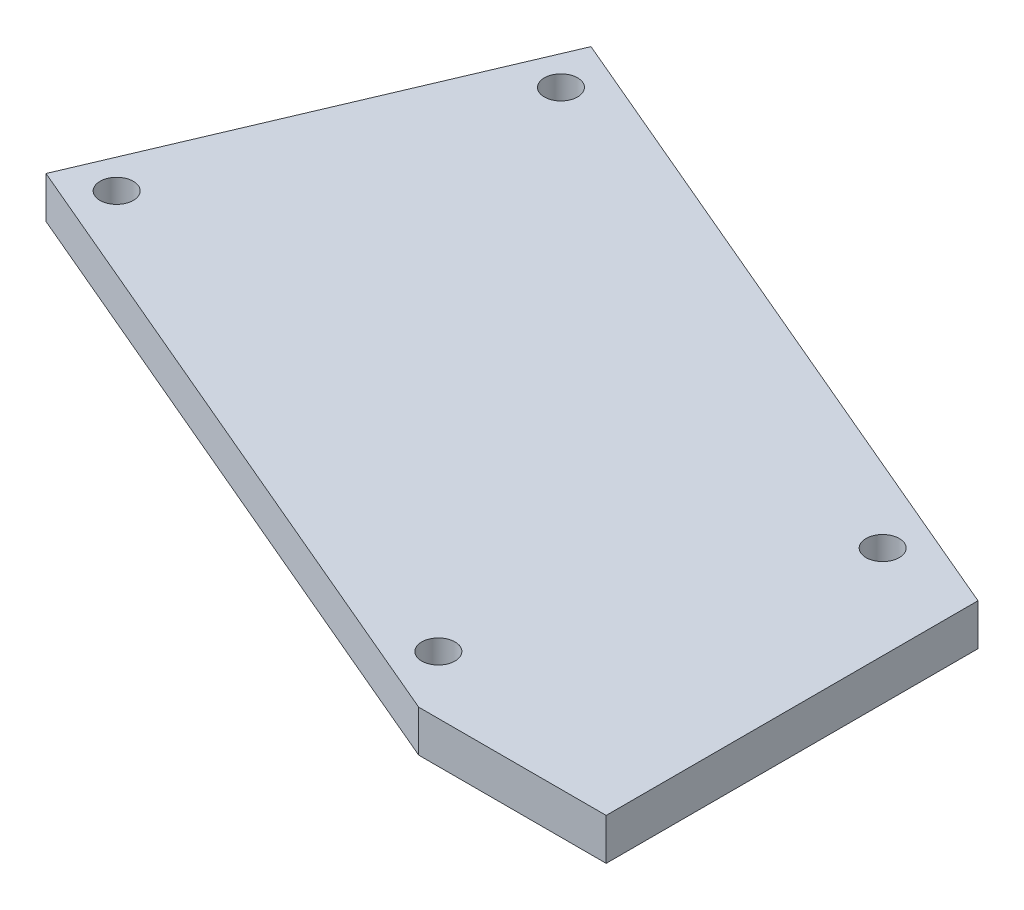
from build123d import *

# Parameters (mm, degrees)
SKETCH1_R           = 1.27
BOSS_EXTRUDE1_DEPTH = 3.175


with BuildPart() as part:
    # Sketch1 → Boss-Extrude1 (new body)
    with BuildSketch(Plane(origin=(0, 0, 0), x_dir=(1, 0, 0), z_dir=(0, 1, 0))):
        Polygon((0, 0), (-51.450921593, 21.881601753), (-63.876832212, -7.335845865), (-14.324041053, -28.410190275), (0, -28.410190275), align=None)
        with Locations((-49.899383574, 18.033755451)):
            Circle(SKETCH1_R, mode=Mode.SUBTRACT)
        with Locations((-60.028985911, -5.784307846)):
            Circle(SKETCH1_R, mode=Mode.SUBTRACT)
        with Locations((-17.257741053, -23.974523249)):
            Circle(SKETCH1_R, mode=Mode.SUBTRACT)
        with Locations((-7.128138716, -0.156459951)):
            Circle(SKETCH1_R, mode=Mode.SUBTRACT)
    extrude(amount=BOSS_EXTRUDE1_DEPTH)


solid = part.part
